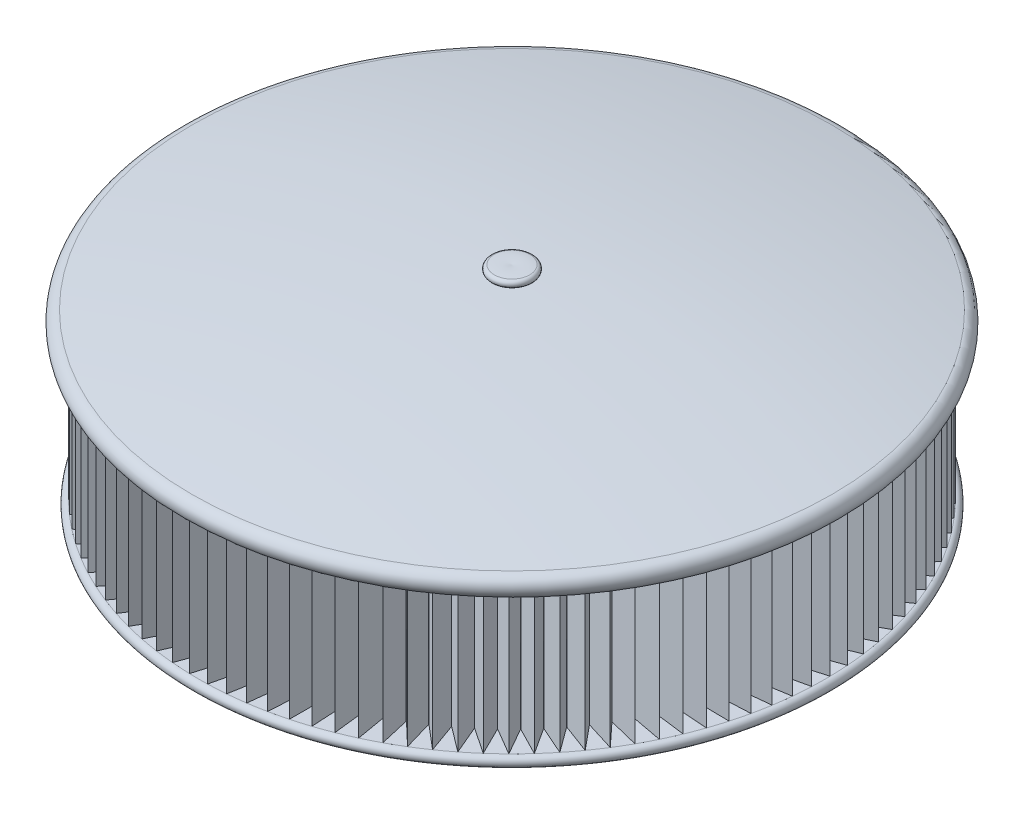
from build123d import *

# Parameters (mm, degrees)
SKETCH1_R           = 60
SKETCH1_R_2         = 55
BOSS_EXTRUDE1_DEPTH = 12
SKETCH2_R           = 90
SKETCH2_R_2         = 50
BOSS_EXTRUDE2_DEPTH = 3
SKETCH3_W           = 5
SKETCH3_H           = 5
BOSS_EXTRUDE3_DEPTH = 40
FILLET1_R           = 1.5
BOSS_EXTRUDE4_REACH = 145.405
CIRPATTERN1_COUNT   = 109


with BuildPart() as part:
    # Sketch1 → Boss-Extrude1 (new body)
    with BuildSketch(Plane(origin=(0, 0, 0), x_dir=(1, 0, 0), z_dir=(0, 1, 0))):
        with Locations(Location((0, 0, 0), (0, 0, 270))):
            Circle(SKETCH1_R)
        with Locations(Location((0, 0, 0), (0, 0, 270))):
            Circle(SKETCH1_R_2, mode=Mode.SUBTRACT)
    extrude(amount=BOSS_EXTRUDE1_DEPTH)

    # Sketch2 → Boss-Extrude2 (add)
    with BuildSketch(Plane(origin=(0, 12, 0), x_dir=(1, 0, 0), z_dir=(0, 1, 0))):
        with Locations(Location((0, 0, 0), (0, 0, 270))):
            Circle(SKETCH2_R)
        with Locations(Location((0, 0, 0), (0, 0, 270))):
            Circle(SKETCH2_R_2, mode=Mode.SUBTRACT)
    extrude(amount=BOSS_EXTRUDE2_DEPTH)

    # Sketch3 → Boss-Extrude3 (add)
    with BuildSketch(Plane(origin=(0, 15, 0), x_dir=(1, 0, 0), z_dir=(0, 1, 0))):
        Polygon((41.442007031, 36.246517808), (44.55945604, 32.337360396), (40.650298628, 29.219911387), (37.532849619, 33.129068799), align=None)
        with Locations((0, 52.5)):
            Rectangle(SKETCH3_W, SKETCH3_H)
        Polygon((54.177337505, -9.801331587), (53.064732835, -14.675971148), (48.190093274, -13.563366478), (49.302697944, -8.688726917), align=None)
        Polygon((26.116027821, -48.468578387), (21.611183482, -50.637997082), (19.441764786, -46.133152743), (23.946609126, -43.963734047), align=None)
        Polygon((-21.611183482, -50.637997082), (-26.116027821, -48.468578387), (-23.946609126, -43.963734047), (-19.441764786, -46.133152743), align=None)
        Polygon((-53.064732835, -14.675971148), (-54.177337505, -9.801331587), (-49.302697944, -8.688726917), (-48.190093274, -13.563366478), align=None)
        Polygon((-44.55945604, 32.337360396), (-41.442007031, 36.246517808), (-37.532849619, 33.129068799), (-40.650298628, 29.219911387), align=None)
    extrude(amount=BOSS_EXTRUDE3_DEPTH)

    # Sketch4 → Revolve1 (revolve)
    with BuildSketch(Plane.XY):
        with BuildLine():
            Line((0, 55), (90, 55))
            ThreePointArc((90, 55), (92.995843327, 57.842130569), (90.315301388, 60.983384829))
            ThreePointArc((90.315301388, 60.983384829), (47.851392688, 67.324881072), (5, 70))
            ThreePointArc((5, 70), (5.881917104, 71), (5, 72))
            ThreePointArc((5, 72), (2.5, 72.156865167), (0, 72))
            Line((0, 72), (0, 70))
            Line((0, 70), (0, 55))
        make_face()
    revolve(axis=Axis((0, 0, 0), (0, 1, 0)))

    # Fillet1
    fillet1_edges = [part.edges().sort_by_distance(p)[0] for p in [
        (0, 15, -90),
        (0, 12, -90),
    ]]
    fillet(fillet1_edges, radius=FILLET1_R - 0.0001)  # a hair under: the kernel refuses the full size

    # Sketch5 → Boss-Extrude4 (add, up to next)
    with BuildSketch(Plane(origin=(0, 15, 0), x_dir=(1, 0, 0), z_dir=(0, 1, 0)), mode=Mode.PRIVATE) as boss_extrude4_sk1:
        Polygon((0, 88.5), (2.277568136, 80), (-2.277568136, 80), align=None)
    boss_extrude4_tool1 = extrude(boss_extrude4_sk1.sketch, amount=BOSS_EXTRUDE4_REACH, mode=Mode.PRIVATE) - part.part
    boss_extrude4 = boss_extrude4_tool1.solids().sort_by_distance((0, 15, -82.833333))[0]
    add(boss_extrude4)

    # CirPattern1: Boss-Extrude4 ×109 about axis
    cirpattern1_axis = Axis((0, 0, 0), (0, 1, 0))
    for i in range(1, CIRPATTERN1_COUNT):
        add(boss_extrude4.rotate(cirpattern1_axis, i * 360 / CIRPATTERN1_COUNT))


solid = part.part
